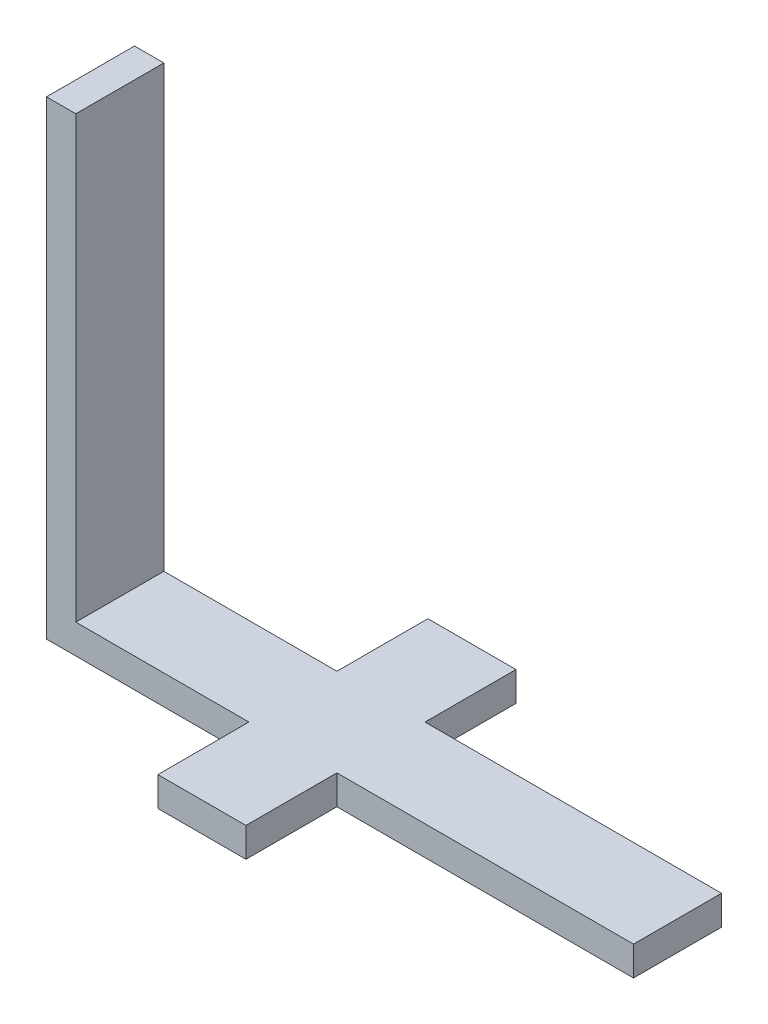
from build123d import *

# Parameters (mm, degrees)
SKETCH1_W           = 100
SKETCH1_H           = 15
BOSS_EXTRUDE1_DEPTH = 5
SKETCH2_W           = 5
SKETCH2_H           = 15
BOSS_EXTRUDE2_DEPTH = 75
SKETCH3_W           = 15
SKETCH3_H           = 15.5
BOSS_EXTRUDE3_DEPTH = 5


with BuildPart() as part:
    # Sketch1 → Boss-Extrude1 (new body)
    with BuildSketch(Plane(origin=(0, 0, 0), x_dir=(1, 0, 0), z_dir=(0, 1, 0))):
        with Locations((-3.34119197, 9.533232324)):
            Rectangle(SKETCH1_W, SKETCH1_H)
    extrude(amount=BOSS_EXTRUDE1_DEPTH)

    # Sketch2 → Boss-Extrude2 (add)
    with BuildSketch(Plane(origin=(0, 5, 0), x_dir=(1, 0, 0), z_dir=(0, 1, 0))):
        with Locations((-50.84119197, 9.533232324)):
            Rectangle(SKETCH2_W, SKETCH2_H)
    extrude(amount=BOSS_EXTRUDE2_DEPTH)

    # Sketch3 → Boss-Extrude3 (add)
    with BuildSketch(Plane(origin=(0, 0, 0), x_dir=(-1, 0, 0), z_dir=(0, -1, 0))):
        with Locations((11.36119197, 24.783232324)):
            Rectangle(SKETCH3_W, SKETCH3_H)
        with Locations((11.36119197, -5.716767676)):
            Rectangle(SKETCH3_W, SKETCH3_H)
    extrude(amount=-BOSS_EXTRUDE3_DEPTH)


solid = part.part
